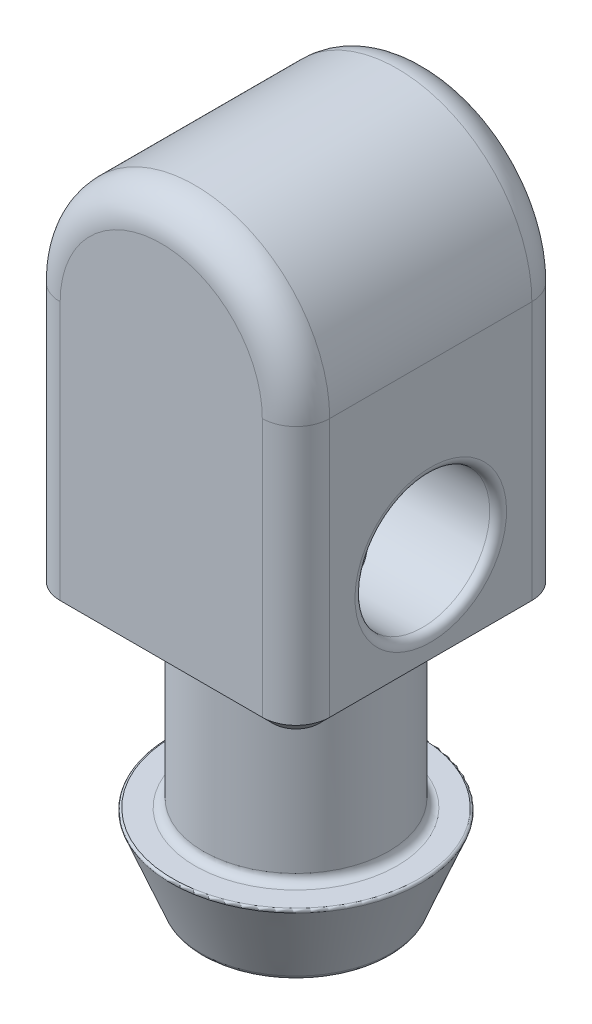
from build123d import *

# Parameters (mm, degrees)
BOSS_EXTRUDE1_DEPTH                        = 6.35
SKETCH3_R                                  = 2.38125
CUT_EXTRUDE1_DEPTH                         = 20.955
CBORE_FOR_1_4_SOCKET_SHOULDER_SCREW1_OUT_R = 3.175
CBORE_FOR_1_4_SOCKET_SHOULDER_SCREW1_DEPTH = 6.35
FILLET1_R                                  = 1.5875
FILLET2_R                                  = 0.396875
FILLET3_R                                  = 0.09921875
CHAMFER1_SIZE                              = 0.508
CHAMFER2_SIZE                              = 0.254


# Read off the part's stored shape, not the designer's step: CBORE for 1/4 Socket Shoulder Screw1
with BuildPart() as part:
    # Sketch1 → Boss-Extrude1 (new, symmetric)
    with BuildSketch(Plane.XY):
        with BuildLine():
            Line((-6.35, 0), (-6.35, -12.7))
            Line((-6.35, -12.7), (6.35, -12.7))
            Line((6.35, -12.7), (6.35, 0))
            ThreePointArc((6.35, 0), (0, 6.35), (-6.35, 0))
        make_face()
    extrude(amount=BOSS_EXTRUDE1_DEPTH, both=True)

    # Sketch2 → Revolve1 (revolve)
    with BuildSketch(Plane.XY, mode=Mode.PRIVATE) as revolve1_sk:
        Polygon((0, -12.7), (4.365625, -12.7), (4.365625, -16.66875), (4.365625, -18.25625), (4.365625, -21.43125), (5.953125, -21.43125), (4.365625, -25.4), (0, -25.4), align=None)
    revolve(revolve1_sk.sketch.rotate(Axis((0, 9.54404991, 0), (0, -1, 0)), 180), axis=Axis((0, 9.54404991, 0), (0, -1, 0)))

    # Sketch3 → Cut-Extrude1 (cut)
    with BuildSketch(Plane.XZ.offset(25.4)):
        Circle(SKETCH3_R)
    extrude(amount=-CUT_EXTRUDE1_DEPTH, mode=Mode.SUBTRACT)

    # CBORE for 1/4 Socket Shoulder Screw1 out → CBORE for 1/4 Socket Shoulder Screw1 (cut)
    with BuildSketch(Plane.YZ):
        with Locations((-7.9375, 0)):
            Circle(CBORE_FOR_1_4_SOCKET_SHOULDER_SCREW1_OUT_R)
    extrude(amount=CBORE_FOR_1_4_SOCKET_SHOULDER_SCREW1_DEPTH, mode=Mode.SUBTRACT)

    # Fillet1
    fillet1_edges = [part.edges().sort_by_distance(p)[0] for p in [
        (-6.35, -6.35, -6.35),
        (6.35, -6.35, -6.35),
        (0, 6.35, 6.35),
        (-6.35, -6.35, 6.35),
        (6.35, -6.35, 6.35),
        (0, 6.35, -6.35),
    ]]
    fillet(fillet1_edges, radius=FILLET1_R)

    # Fillet2
    fillet2_edges = [part.edges().sort_by_distance(p)[0] for p in [
        (4.365625, -12.7, 0),
        (4.365625, -21.43125, 0),
        (4.365625, -25.4, 0),
        (6.35, -11.1125, 0),
    ]]
    fillet(fillet2_edges, radius=FILLET2_R)

    # Fillet3
    fillet3_edges = [part.edges().sort_by_distance(p)[0] for p in [
        (5.953125, -21.43125, 0),
    ]]
    fillet(fillet3_edges, radius=FILLET3_R)

    # Chamfer1
    chamfer1_edges = [part.edges().sort_by_distance(p)[0] for p in [
        (6.35, -12.7, 0),
        (0, -12.7, -6.35),
        (0, -12.7, 6.35),
        (-6.35, -12.7, 0),
        (5.885032015, -12.7, 5.885032015),
        (-5.885032015, -12.7, 5.885032015),
        (-5.885032015, -12.7, -5.885032015),
        (5.885032015, -12.7, -5.885032015),
    ]]
    chamfer(chamfer1_edges, length=CHAMFER1_SIZE)

    # Chamfer2
    chamfer2_edges = [part.edges().sort_by_distance(p)[0] for p in [
        (-2.38125, -25.4, 0),
    ]]
    chamfer(chamfer2_edges, length=CHAMFER2_SIZE)


solid = part.part
